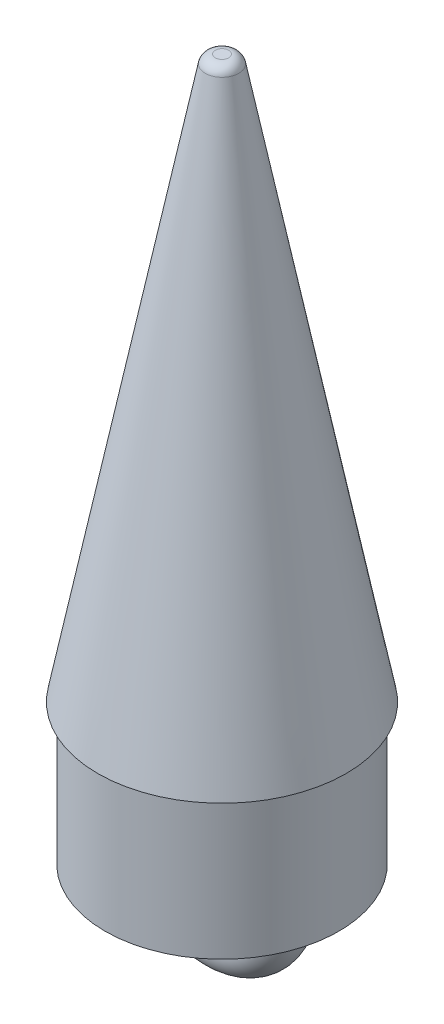
from build123d import *

# Parameters (mm, degrees)
SKETCH1_R           = 31.75
BOSS_EXTRUDE1_DEPTH = 38.1
SKETCH2_R           = 33.734375
BOSS_EXTRUDE2_DEPTH = 152.4
BOSS_EXTRUDE2_TAPER = 11
FILLET1_R           = 2.794
SKETCH4_R           = 6.35
REVOLVE1_ANGLE      = 180
SKETCH5_R           = 31.75
BOSS_EXTRUDE3_DEPTH = 6.35


# Read off the part's stored shape, not the designer's step: Shell3
with BuildPart() as part:
    # Sketch1 → Boss-Extrude1 (new body)
    with BuildSketch(Plane(origin=(0, 0, 0), x_dir=(1, 0, 0), z_dir=(0, 1, 0))):
        with Locations(Location((0, 0, 0), (0, 0, 90))):
            Circle(SKETCH1_R)
    extrude(amount=BOSS_EXTRUDE1_DEPTH)

    # Sketch2 → Boss-Extrude2 (add)
    with BuildSketch(Plane(origin=(0, 38.1, 0), x_dir=(1, 0, 0), z_dir=(0, 1, 0))):
        Circle(SKETCH2_R)
    extrude(amount=BOSS_EXTRUDE2_DEPTH, taper=BOSS_EXTRUDE2_TAPER)

    # Fillet1
    fillet1_edges = [part.edges().sort_by_distance(p)[0] for p in [
        (-4.110815887, 190.5, 0),
    ]]
    fillet(fillet1_edges, radius=FILLET1_R)

    # Shell3 outline → Shell3 (revolve, cut)
    with BuildSketch(Plane.XY):
        with BuildLine():
            Line((32.193741805, 39.37), (3.303619853, 187.996792909))
            ThreePointArc((3.303619853, 187.996792909), (2.777003233, 188.881955865), (1.807620025, 189.23))
            Line((1.807620025, 189.23), (0, 189.23))
            Line((0, 189.23), (0, 1.27))
            Line((0, 1.27), (30.48, 1.27))
            Line((30.48, 1.27), (30.48, 39.37))
            Line((30.48, 39.37), (32.193741805, 39.37))
        make_face()
    revolve(axis=Axis((0, 0, 0), (0, 1, 0)), mode=Mode.SUBTRACT)

    # Sketch4 → Revolve1 (revolve)
    with BuildSketch(Plane.XZ):
        with Locations((-17.08043758, 0)):
            Circle(SKETCH4_R)
    revolve(axis=Axis((0, 0, 0), (0, 0, 1)), revolution_arc=REVOLVE1_ANGLE)

    # Sketch5 → Boss-Extrude3 (add)
    with BuildSketch(Plane.XZ):
        with Locations(Location((0, 0, 0), (0, 0, 270))):
            Circle(SKETCH5_R)
    extrude(amount=-BOSS_EXTRUDE3_DEPTH)


solid = part.part
